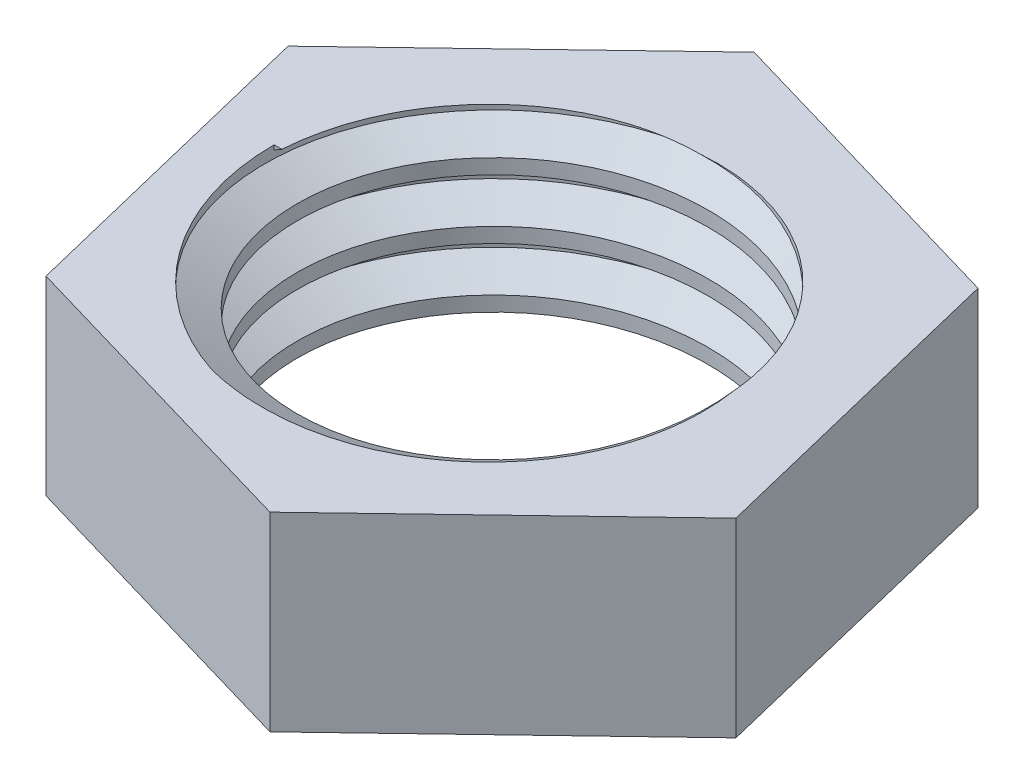
from build123d import *

# Parameters (mm, degrees)
BOSS_EXTRUDE1_DEPTH = 4
SKETCH2_R           = 5
CUT_EXTRUDE1_DEPTH  = 11.272655189
THREAD2_PITCH       = 1.25
SKETCH7_R           = 21.028311622
CUT_EXTRUDE2_DEPTH  = 11.701830703
SKETCH8_R           = 21.037382845
CUT_EXTRUDE3_DEPTH  = 11.272655358


with BuildPart() as part:
    # Sketch1 → Boss-Extrude1 (new body)
    with BuildSketch(Plane(origin=(0, 0, 0), x_dir=(1, 0, 0), z_dir=(0, 1, 0))):
        Polygon((5.00756352, 4.787933541), (-1.642690318, 6.73064399), (-6.650253838, 1.942710449), (-5.00756352, -4.787933541), (1.642690318, -6.73064399), (6.650253838, -1.942710449), align=None)
    extrude(amount=BOSS_EXTRUDE1_DEPTH)

    # Sketch2 → Cut-Extrude1 (cut, through all)
    with BuildSketch(Plane(origin=(0, 4, 0), x_dir=(1, 0, 0), z_dir=(0, 1, 0))):
        with Locations(Location((0, 0, 0), (0, 0, 270))):
            Circle(SKETCH2_R)
    extrude(amount=-CUT_EXTRUDE1_DEPTH, mode=Mode.SUBTRACT)

    # Thread2: the profile of Thread Profile2 profile screwed along a right-hand helix of 6.4 turns, 8 arcs to a turn; built about Z, then put on its axis
    thread2_z = Axis((0, 0, 0), (0, 0, 1))
    thread2_corners = [(5.0003, 0, -0.000173205), (5.0003, 0, 1.093923202), (4.323417656, 0, 0.703124998), (4.323417656, 0, 0.390624998)]
    with BuildLine(mode=Mode.PRIVATE) as thread2_profile:
        Line(thread2_corners[0], thread2_corners[1])
        Line(thread2_corners[1], thread2_corners[2])
        Line(thread2_corners[2], thread2_corners[3])
        Line(thread2_corners[3], thread2_corners[0])
    thread2_cap = Face(thread2_profile.wire())
    thread2_turn_angles = [0, 22.5, 45, 67.5, 90, 112.5, 135, 157.5, 180, 202.5, 225, 247.5, 270, 292.5, 315, 337.5, 360]
    thread2_turn_weights = [1, 0.9238795325112867, 1, 0.9238795325112867, 1, 0.9238795325112867, 1, 0.9238795325112867, 1, 0.9238795325112867, 1, 0.9238795325112867, 1, 0.9238795325112867, 1, 0.9238795325112867, 1]
    thread2_turn_rails = [Edge.make_bspline([Vector(p[0], p[1], 0).rotate(thread2_z, thread2_turn_angles[k]) / thread2_turn_weights[k] + Vector(0, 0, p[2] + THREAD2_PITCH * thread2_turn_angles[k] / 360) for k in range(17)], [0, 0, 0, 1, 1, 2, 2, 3, 3, 4, 4, 5, 5, 6, 6, 7, 7, 8, 8, 8], 2, thread2_turn_weights) for p in thread2_corners]
    thread2_turn_sides = [Face.make_surface_from_curves(thread2_turn_rails[p[0]], thread2_turn_rails[p[1]]) for p in [(0, 1), (1, 2), (2, 3), (3, 0)]]
    thread2_last_angles = [2160, 2182.5, 2205, 2227.5, 2250, 2272.5, 2295, 2299.5, 2304]
    thread2_last_weights = [1, 0.9238795325112867, 1, 0.9238795325112867, 1, 0.9238795325112867, 1, 0.996917333733128, 1]
    thread2_last_rails = [Edge.make_bspline([Vector(p[0], p[1], 0).rotate(thread2_z, thread2_last_angles[k]) / thread2_last_weights[k] + Vector(0, 0, p[2] + THREAD2_PITCH * thread2_last_angles[k] / 360) for k in range(9)], [0, 0, 0, 1, 1, 2, 2, 3, 3, 4, 4, 4], 2, thread2_last_weights) for p in thread2_corners]
    thread2_last_sides = [Face.make_surface_from_curves(thread2_last_rails[p[0]], thread2_last_rails[p[1]]) for p in [(0, 1), (1, 2), (2, 3), (3, 0)]]
    thread2 = Plane(origin=(0, 5, 0), x_dir=(-1, 0, 0), z_dir=(0, -1, 0)) * Solid(Shell([*[p.moved(Location((0, 0, THREAD2_PITCH * i))) for i in range(6) for p in thread2_turn_sides], *thread2_last_sides, thread2_cap, thread2_cap.rotate(thread2_z, 2304).moved(Location((0, 0, THREAD2_PITCH * 2304 / 360)))]))
    add(thread2)

    # Sketch7 → Cut-Extrude2 (cut, through all)
    with BuildSketch(Plane.XZ):
        with Locations((-8.727451128, 7.028819701)):
            Circle(SKETCH7_R)
    extrude(amount=CUT_EXTRUDE2_DEPTH, mode=Mode.SUBTRACT)

    # Sketch8 → Cut-Extrude3 (cut, through all)
    with BuildSketch(Plane(origin=(0, 4, 0), x_dir=(1, 0, 0), z_dir=(0, 1, 0))):
        with Locations((-10.113690569, 5.935447747)):
            Circle(SKETCH8_R)
    extrude(amount=CUT_EXTRUDE3_DEPTH, mode=Mode.SUBTRACT)


solid = part.part
